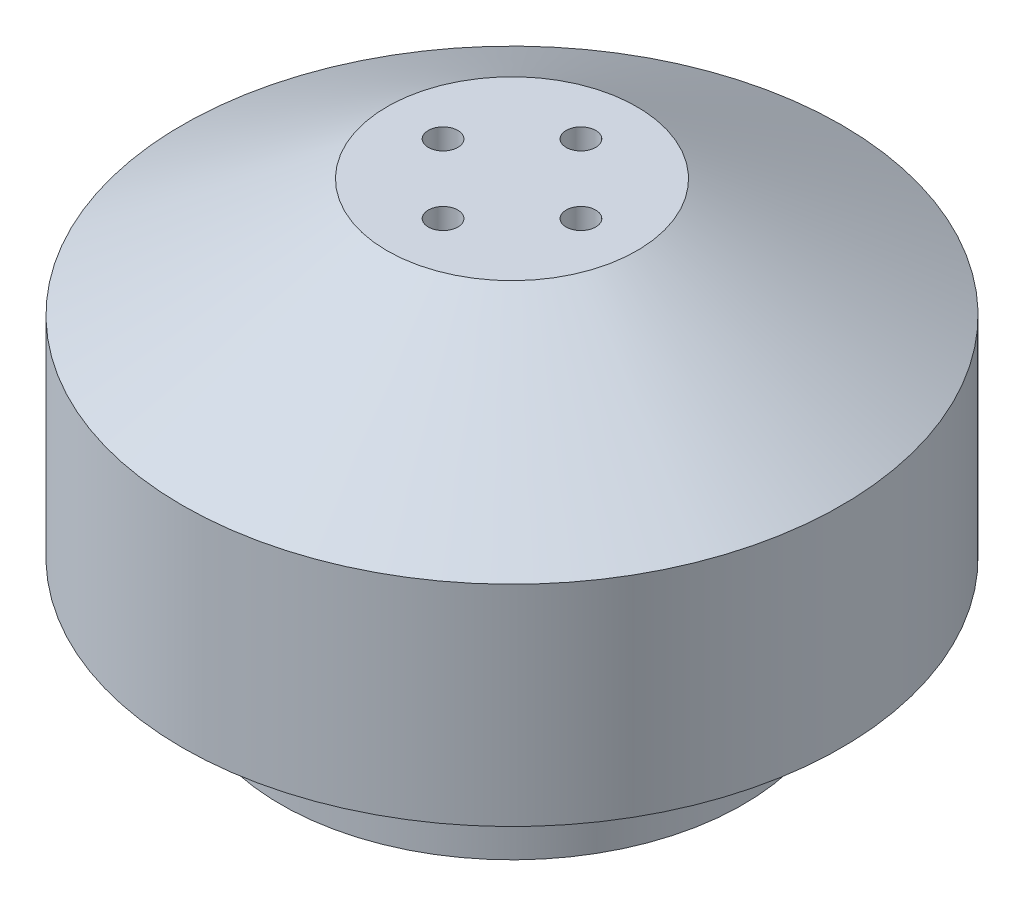
from build123d import *

# Parameters (mm, degrees)
SKETCH1_R           = 21.25
BOSS_EXTRUDE1_DEPTH = 27.5
SKETCH2_R           = 21.25
SKETCH2_R_2         = 14.9
CUT_EXTRUDE1_DEPTH  = 6.35
CHAMFER1_SIZE       = 7.62
CHAMFER1_SIZE2      = 13.198227154
SKETCH3_R           = 0.9525
CUT_EXTRUDE2_DEPTH  = 6.35


with BuildPart() as part:
    # Sketch1 → Boss-Extrude1 (new body)
    with BuildSketch(Plane(origin=(0, 0, 0), x_dir=(1, 0, 0), z_dir=(0, 1, 0))):
        Circle(SKETCH1_R)
    extrude(amount=BOSS_EXTRUDE1_DEPTH)

    # Sketch2 → Cut-Extrude1 (cut)
    with BuildSketch(Plane.XZ):
        Circle(SKETCH2_R)
        Circle(SKETCH2_R_2, mode=Mode.SUBTRACT)
    extrude(amount=-CUT_EXTRUDE1_DEPTH, mode=Mode.SUBTRACT)

    # Chamfer1
    chamfer1_edges = [part.edges().sort_by_distance(p)[0] for p in [
        (-21.25, 27.5, 0),
    ]]
    chamfer1_side = [part.faces().sort_by_distance(p)[0] for p in [
        (-21.25, 16.925, 0),
    ]]
    chamfer(chamfer1_edges, length=CHAMFER1_SIZE, length2=CHAMFER1_SIZE2, reference=chamfer1_side[0])

    # Sketch3 → Cut-Extrude2 (cut)
    with BuildSketch(Plane(origin=(0, 27.5, 0), x_dir=(1, 0, 0), z_dir=(0, 1, 0))):
        with Locations((0, 4.445)):
            Circle(SKETCH3_R)
        with Locations((4.445, 0)):
            Circle(SKETCH3_R)
        with Locations((0, -4.445)):
            Circle(SKETCH3_R)
        with Locations((-4.445, 0)):
            Circle(SKETCH3_R)
    extrude(amount=-CUT_EXTRUDE2_DEPTH, mode=Mode.SUBTRACT)


solid = part.part
